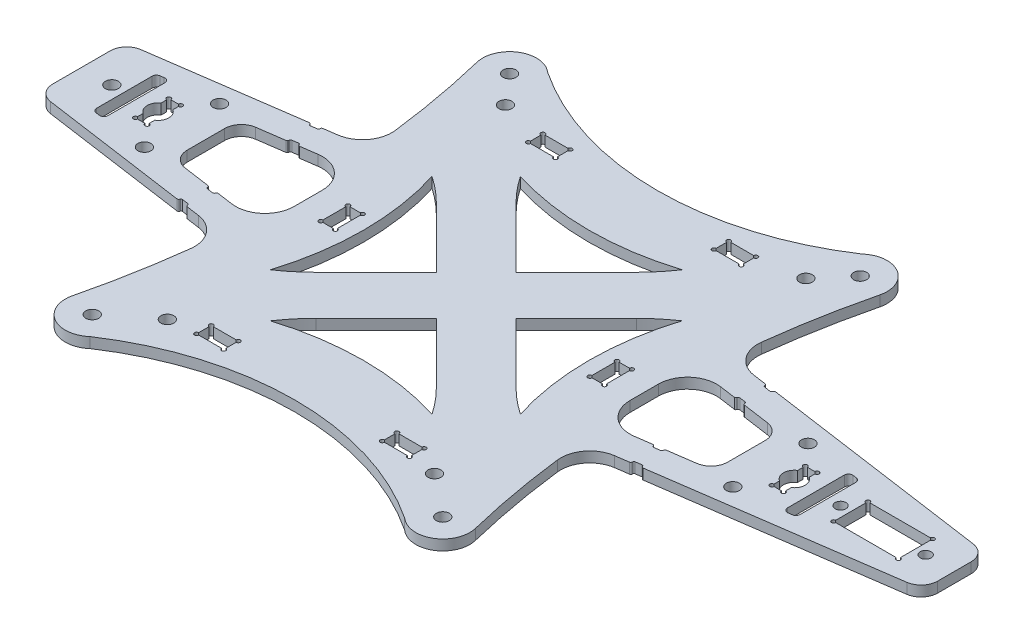
from build123d import *

# Parameters (mm, degrees)
SKETCH_1_R             = 1.55
SKETCH_1_R_2           = 1.3
SKETCH_1_W             = 6.5
SKETCH_1_H             = 3.5
SKETCH_1_W_2           = 3.5
SKETCH_1_H_2           = 6.5
SKETCH_1_W_3           = 15.5
SKETCH_1_H_3           = 8.2
EXTRUDE_1_DEPTH        = 2.5
FILLET_1_R             = 4
FILLET_2_R             = 7
CUT_EXTRUDE_3_DEPTH    = 128.770204339
FILLET_5_R             = 0.35
FILLET_4_R             = 1
SKETCH_2_R             = 0.5
CUT_EXTRUDE_7504_DEPTH = 128.770204339


with BuildPart() as part:
    # 草图1 → 凸台-拉伸1 (new body)
    with BuildSketch(Plane(origin=(0, 0, 0), x_dir=(1, 0, 0), z_dir=(0, 1, 0))):
        with BuildLine():
            Line((114.591143215, 7.468307572), (114.591143215, -7.468307572))
            Line((114.591143215, -7.468307572), (43.193640968, -17.646273029))
            ThreePointArc((43.193640968, -17.646273029), (45.143245402, -33.15226541), (48.27557779, -48.463217404))
            ThreePointArc((48.27557779, -48.463217404), (45.335063646, -55.533708325), (37.709796983, -54.831018053))
            ThreePointArc((37.709796983, -54.831018053), (0, -43.436211003), (-37.709796983, -54.831018053))
            ThreePointArc((-37.709796983, -54.831018053), (-45.335063646, -55.533708325), (-48.27557779, -48.463217404))
            ThreePointArc((-48.27557779, -48.463217404), (-45.143245402, -33.15226541), (-43.193640968, -17.646273029))
            Line((-43.193640968, -17.646273029), (-94.579518436, -10.321035179))
            Line((-94.579518436, -10.321035179), (-94.579518436, 10.321035179))
            Line((-94.579518436, 10.321035179), (-43.193640968, 17.646273029))
            ThreePointArc((-43.193640968, 17.646273029), (-45.143245402, 33.15226541), (-48.27557779, 48.463217404))
            ThreePointArc((-48.27557779, 48.463217404), (-45.335063646, 55.533708325), (-37.709796983, 54.831018053))
            ThreePointArc((-37.709796983, 54.831018053), (0, 43.436211003), (37.709796983, 54.831018053))
            ThreePointArc((37.709796983, 54.831018053), (45.335063646, 55.533708325), (48.27557779, 48.463217404))
            ThreePointArc((48.27557779, 48.463217404), (45.143245402, 33.15226541), (43.193640968, 17.646273029))
            Line((43.193640968, 17.646273029), (114.591143215, 7.468307572))
        make_face()
        with Locations((-36, 43)):
            Circle(SKETCH_1_R, mode=Mode.SUBTRACT)
        with Locations((-32, -42)):
            Circle(SKETCH_1_R, mode=Mode.SUBTRACT)
        with Locations((32, -42)):
            Circle(SKETCH_1_R, mode=Mode.SUBTRACT)
        with Locations((36, 43)):
            Circle(SKETCH_1_R, mode=Mode.SUBTRACT)
        with Locations((42, 50)):
            Circle(SKETCH_1_R, mode=Mode.SUBTRACT)
        with Locations((42, -50)):
            Circle(SKETCH_1_R, mode=Mode.SUBTRACT)
        with Locations((-42, -50)):
            Circle(SKETCH_1_R, mode=Mode.SUBTRACT)
        with Locations((-42, 50)):
            Circle(SKETCH_1_R, mode=Mode.SUBTRACT)
        with Locations((107.7, 0)):
            Circle(SKETCH_1_R_2, mode=Mode.SUBTRACT)
        with Locations((87.3, 0)):
            Circle(SKETCH_1_R_2, mode=Mode.SUBTRACT)
        with Locations((70.5, 9)):
            Circle(SKETCH_1_R, mode=Mode.SUBTRACT)
        with Locations((70.5, -9)):
            Circle(SKETCH_1_R, mode=Mode.SUBTRACT)
        with Locations((-70.5, -9)):
            Circle(SKETCH_1_R, mode=Mode.SUBTRACT)
        with Locations((-70.5, 9)):
            Circle(SKETCH_1_R, mode=Mode.SUBTRACT)
        with Locations((-87.3, 0)):
            Circle(SKETCH_1_R, mode=Mode.SUBTRACT)
        with Locations((-22.25, 39.75)):
            Rectangle(SKETCH_1_W, SKETCH_1_H, mode=Mode.SUBTRACT)
        with Locations((-32.25, 0)):
            Rectangle(SKETCH_1_W_2, SKETCH_1_H_2, mode=Mode.SUBTRACT)
        with Locations((-22.25, -39.75)):
            Rectangle(SKETCH_1_W, SKETCH_1_H, mode=Mode.SUBTRACT)
        with Locations((22.25, 39.75)):
            Rectangle(SKETCH_1_W, SKETCH_1_H, mode=Mode.SUBTRACT)
        with Locations((22.25, -39.75)):
            Rectangle(SKETCH_1_W, SKETCH_1_H, mode=Mode.SUBTRACT)
        with Locations((32.25, 0)):
            Rectangle(SKETCH_1_W_2, SKETCH_1_H_2, mode=Mode.SUBTRACT)
        with BuildLine():
            Line((77.65, -2.151778405), (77.65, -4))
            Line((77.65, -4), (74.85, -4))
            Line((74.85, -4), (74.85, -2.176778405))
            ThreePointArc((74.85, -2.176778405), (73.652957971, 0), (74.85, 2.176778405))
            Line((74.85, 2.176778405), (74.85, 4))
            Line((74.85, 4), (77.65, 4))
            Line((77.65, 4), (77.65, 2.151778405))
            ThreePointArc((77.65, 2.151778405), (78.8083942, 0), (77.65, -2.151778405))
        make_face(mode=Mode.SUBTRACT)
        with Locations((97.5, 0)):
            Rectangle(SKETCH_1_W_3, SKETCH_1_H_3, mode=Mode.SUBTRACT)
        with BuildLine():
            Line((-74.85, -2.176778405), (-74.85, -4))
            Line((-74.85, -4), (-77.65, -4))
            Line((-77.65, -4), (-77.65, -2.151778405))
            ThreePointArc((-77.65, -2.151778405), (-78.8083942, 0), (-77.65, 2.151778405))
            Line((-77.65, 2.151778405), (-77.65, 4))
            Line((-77.65, 4), (-74.85, 4))
            Line((-74.85, 4), (-74.85, 2.176778405))
            ThreePointArc((-74.85, 2.176778405), (-73.652957971, 0), (-74.85, -2.176778405))
        make_face(mode=Mode.SUBTRACT)
        with BuildLine():
            Line((-23.978041684, 14.429581723), (-9.54845996, 0))
            Line((-9.54845996, 0), (-23.978041684, -14.429581723))
            ThreePointArc((-23.978041684, -14.429581723), (-26.851664039, -17.042325553), (-29.960234119, -19.370614155))
            ThreePointArc((-29.960234119, -19.370614155), (-27.006361348, 0), (-29.960234119, 19.370614155))
            ThreePointArc((-29.960234119, 19.370614155), (-26.851664039, 17.042325553), (-23.978041684, 14.429581723))
        make_face(mode=Mode.SUBTRACT)
        with BuildLine():
            Line((14.429581723, 23.978041684), (0, 9.54845996))
            Line((0, 9.54845996), (-14.429581723, 23.978041684))
            ThreePointArc((-14.429581723, 23.978041684), (-17.042325553, 26.851664039), (-19.370614155, 29.960234119))
            ThreePointArc((-19.370614155, 29.960234119), (0, 27.006361348), (19.370614155, 29.960234119))
            ThreePointArc((19.370614155, 29.960234119), (17.042325553, 26.851664039), (14.429581723, 23.978041684))
        make_face(mode=Mode.SUBTRACT)
        with BuildLine():
            Line((23.978041684, -14.429581723), (9.54845996, 0))
            Line((9.54845996, 0), (23.978041684, 14.429581723))
            ThreePointArc((23.978041684, 14.429581723), (26.851664039, 17.042325553), (29.960234119, 19.370614155))
            ThreePointArc((29.960234119, 19.370614155), (27.006361348, 0), (29.960234119, -19.370614155))
            ThreePointArc((29.960234119, -19.370614155), (26.851664039, -17.042325553), (23.978041684, -14.429581723))
        make_face(mode=Mode.SUBTRACT)
        with BuildLine():
            Line((-14.429581723, -23.978041684), (0, -9.54845996))
            Line((0, -9.54845996), (14.429581723, -23.978041684))
            ThreePointArc((14.429581723, -23.978041684), (17.042325553, -26.851664039), (19.370614155, -29.960234119))
            ThreePointArc((19.370614155, -29.960234119), (0, -27.006361348), (-19.370614155, -29.960234119))
            ThreePointArc((-19.370614155, -29.960234119), (-17.042325553, -26.851664039), (-14.429581723, -23.978041684))
        make_face(mode=Mode.SUBTRACT)
        Polygon((-64.75, -7.957119899), (-64.75, 7.957119899), (-40.25, 11.449681205), (-40.25, -11.449681205), align=None, mode=Mode.SUBTRACT)
        Polygon((64.75, 7.957119899), (40.25, 11.449681205), (40.25, -11.449681205), (64.75, -7.957119899), align=None, mode=Mode.SUBTRACT)
        Polygon((84.3, 7.543714683), (81.4, 7.957119899), (81.4, -7.957119899), (84.3, -7.543714683), align=None, mode=Mode.SUBTRACT)
        Polygon((-84.3, 7.543714683), (-84.3, -7.543714683), (-81.4, -7.957119899), (-81.4, 7.957119899), align=None, mode=Mode.SUBTRACT)
    extrude(amount=EXTRUDE_1_DEPTH)

    # 圆角1
    fillet_1_edges = [part.edges().sort_by_distance(p)[0] for p in [
        (114.591143215, 1.25, -7.468307572),
        (114.591143215, 1.25, 7.468307572),
        (-94.579518436, 1.25, 10.321035179),
        (-94.579518436, 1.25, -10.321035179),
        (-64.75, 1.25, 7.957119899),
        (-64.75, 1.25, -7.957119899),
        (64.75, 1.25, 7.957119899),
        (64.75, 1.25, -7.957119899),
    ]]
    fillet(fillet_1_edges, radius=FILLET_1_R)

    # 圆角2
    fillet_2_edges = [part.edges().sort_by_distance(p)[0] for p in [
        (43.193640968, 1.25, -17.646273029),
        (43.193640968, 1.25, 17.646273029),
        (-43.193640968, 1.25, 17.646273029),
        (-43.193640968, 1.25, -17.646273029),
        (40.25, 1.25, 11.449681205),
        (40.25, 1.25, -11.449681205),
        (-40.25, 1.25, 11.449681205),
        (-40.25, 1.25, -11.449681205),
    ]]
    fillet(fillet_2_edges, radius=FILLET_2_R)

    # 草图6 → 切除-拉伸3 (cut, through all)
    with BuildSketch(Plane(origin=(0, 2.5, 0), x_dir=(1, 0, 0), z_dir=(0, 1, 0))):
        Polygon((53.295953363, 16.20615281), (55.637277294, 15.872388836), (55.245478476, 15.271669864), (53.295953363, 15.549581537), align=None)
        Polygon((54.504562879, 10.074214326), (52.555037767, 10.352125998), (52.371572952, 9.72170828), (54.712896883, 9.387944306), align=None)
        Polygon((52.555037767, -10.352125998), (52.371572952, -9.72170828), (54.712896883, -9.387944306), (54.504562879, -10.074214326), align=None)
        Polygon((53.295953363, -15.549581537), (53.295953363, -16.20615281), (55.637277294, -15.872388836), (55.245478476, -15.271669864), align=None)
        Polygon((-53.295953363, -16.20615281), (-55.637277294, -15.872388836), (-55.245478476, -15.271669864), (-53.295953363, -15.549581537), align=None)
        Polygon((-54.504562879, -10.074214326), (-52.555037767, -10.352125998), (-52.371572952, -9.72170828), (-54.712896883, -9.387944306), align=None)
        Polygon((-52.555037767, 10.352125998), (-52.371572952, 9.72170828), (-54.712896883, 9.387944306), (-54.504562879, 10.074214326), align=None)
        Polygon((-53.295953363, 15.549581537), (-53.295953363, 16.20615281), (-55.637277294, 15.872388836), (-55.245478476, 15.271669864), align=None)
    extrude(amount=-CUT_EXTRUDE_3_DEPTH, mode=Mode.SUBTRACT)

    # 圆角5
    fillet_5_edges = [part.edges().sort_by_distance(p)[0] for p in [
        (-55.637277294, 1.25, -15.872388836),
        (-55.245478476, 1.25, -15.271669864),
        (-53.295953363, 1.25, -15.549581537),
        (-53.295953363, 1.25, -16.20615281),
        (-52.371572952, 1.25, 9.72170828),
        (-52.555037767, 1.25, 10.352125998),
        (-54.504562879, 1.25, 10.074214326),
        (-54.712896883, 1.25, 9.387944306),
        (-52.371572952, 1.25, -9.72170828),
        (-52.555037767, 1.25, -10.352125998),
        (-54.712896883, 1.25, -9.387944306),
        (-54.504562879, 1.25, -10.074214326),
        (-53.295953363, 1.25, 16.20615281),
        (-53.295953363, 1.25, 15.549581537),
        (-55.245478476, 1.25, 15.271669864),
        (-55.637277294, 1.25, 15.872388836),
        (55.637277294, 1.25, 15.872388836),
        (55.245478476, 1.25, 15.271669864),
        (53.295953363, 1.25, 15.549581537),
        (53.295953363, 1.25, 16.20615281),
        (54.712896883, 1.25, 9.387944306),
        (54.504562879, 1.25, 10.074214326),
        (52.555037767, 1.25, 10.352125998),
        (52.371572952, 1.25, 9.72170828),
        (54.712896883, 1.25, -9.387944306),
        (54.504562879, 1.25, -10.074214326),
        (52.371572952, 1.25, -9.72170828),
        (52.555037767, 1.25, -10.352125998),
        (55.245478476, 1.25, -15.271669864),
        (53.295953363, 1.25, -15.549581537),
        (55.637277294, 1.25, -15.872388836),
        (53.295953363, 1.25, -16.20615281),
    ]]
    fillet(fillet_5_edges, radius=FILLET_5_R)

    # 圆角4
    fillet_4_edges = [part.edges().sort_by_distance(p)[0] for p in [
        (-81.4, 1.25, 7.957119899),
        (-84.3, 1.25, 7.543714683),
        (-84.3, 1.25, -7.543714683),
        (-81.4, 1.25, -7.957119899),
        (81.4, 1.25, 7.957119899),
        (84.3, 1.25, 7.543714683),
        (84.3, 1.25, -7.543714683),
        (81.4, 1.25, -7.957119899),
    ]]
    fillet(fillet_4_edges, radius=FILLET_4_R)

    # 草图2 → Cut-Extrude 7504 (cut, through all)
    with BuildSketch(Plane(origin=(0, 2.5, 0), x_dir=(1, 0, 0), z_dir=(0, 1, 0))):
        with Locations((-77.65, 4)):
            Circle(SKETCH_2_R)
        with Locations((-74.85, 4)):
            Circle(SKETCH_2_R)
        with Locations((-77.65, -4)):
            Circle(SKETCH_2_R)
        with Locations((-74.85, -4)):
            Circle(SKETCH_2_R)
        with Locations((-25.5, 41.5)):
            Circle(SKETCH_2_R)
        with Locations((-19, 41.5)):
            Circle(SKETCH_2_R)
        with Locations((-25.5, 38)):
            Circle(SKETCH_2_R)
        with Locations((-19, 38)):
            Circle(SKETCH_2_R)
        with Locations((-34, 3.25)):
            Circle(SKETCH_2_R)
        with Locations((-30.5, 3.25)):
            Circle(SKETCH_2_R)
        with Locations((-34, -3.25)):
            Circle(SKETCH_2_R)
        with Locations((-30.5, -3.25)):
            Circle(SKETCH_2_R)
        with Locations((-25.5, -38)):
            Circle(SKETCH_2_R)
        with Locations((-19, -38)):
            Circle(SKETCH_2_R)
        with Locations((-25.5, -41.5)):
            Circle(SKETCH_2_R)
        with Locations((-19, -41.5)):
            Circle(SKETCH_2_R)
        with Locations((19, -41.5)):
            Circle(SKETCH_2_R)
        with Locations((25.5, -41.5)):
            Circle(SKETCH_2_R)
        with Locations((19, -38)):
            Circle(SKETCH_2_R)
        with Locations((25.5, -38)):
            Circle(SKETCH_2_R)
        with Locations((30.5, -3.25)):
            Circle(SKETCH_2_R)
        with Locations((34, -3.25)):
            Circle(SKETCH_2_R)
        with Locations((30.5, 3.25)):
            Circle(SKETCH_2_R)
        with Locations((34, 3.25)):
            Circle(SKETCH_2_R)
        with Locations((19, 38)):
            Circle(SKETCH_2_R)
        with Locations((25.5, 38)):
            Circle(SKETCH_2_R)
        with Locations((19, 41.5)):
            Circle(SKETCH_2_R)
        with Locations((25.5, 41.5)):
            Circle(SKETCH_2_R)
        with Locations((74.85, -4)):
            Circle(SKETCH_2_R)
        with Locations((77.65, -4)):
            Circle(SKETCH_2_R)
        with Locations((74.85, 4)):
            Circle(SKETCH_2_R)
        with Locations((77.65, 4)):
            Circle(SKETCH_2_R)
        with Locations((89.75, 4.1)):
            Circle(SKETCH_2_R)
        with Locations((105.25, 4.1)):
            Circle(SKETCH_2_R)
        with Locations((89.75, -4.1)):
            Circle(SKETCH_2_R)
        with Locations((105.25, -4.1)):
            Circle(SKETCH_2_R)
    extrude(amount=-CUT_EXTRUDE_7504_DEPTH, mode=Mode.SUBTRACT)


solid = part.part
